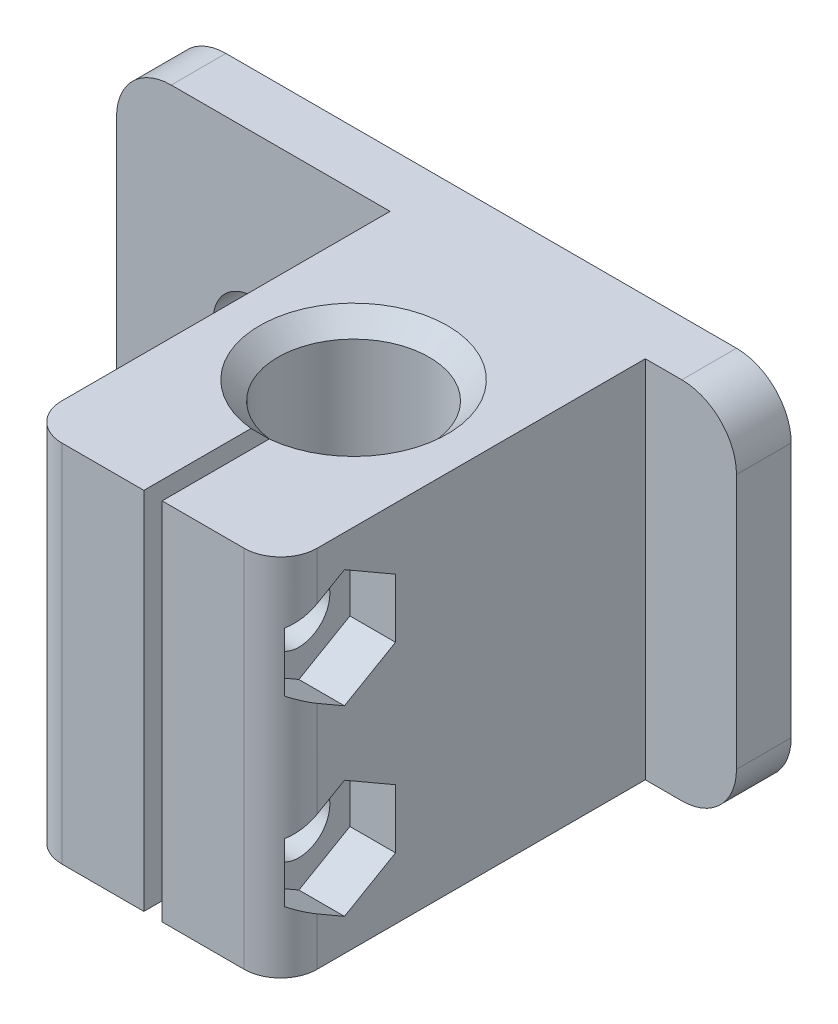
from build123d import *

# Parameters (mm, degrees)
SKETCH1_W           = 34
SKETCH1_H           = 20
BOSS_EXTRUDE1_DEPTH = 3
FILLET1_R           = 3
SKETCH2_W           = 14
SKETCH2_H           = 20
BOSS_EXTRUDE2_DEPTH = 20
CUT_EXTRUDE1_DEPTH  = 35.899856733
CHAMFER1_SIZE       = 1
SKETCH4_R           = 2.2
CUT_EXTRUDE2_DEPTH  = 29.08914381
SKETCH5_R           = 1.7
CUT_EXTRUDE3_DEPTH  = 39.340579025
FILLET2_R           = 2
CUT_EXTRUDE4_DEPTH  = 2.5
SKETCH7_R           = 2.75
CUT_EXTRUDE5_DEPTH  = 3


with BuildPart() as part:
    # Sketch1 → Boss-Extrude1 (new body)
    with BuildSketch(Plane.XY):
        Rectangle(SKETCH1_W, SKETCH1_H)
    extrude(amount=BOSS_EXTRUDE1_DEPTH)

    # Fillet1
    fillet1_edges = [part.edges().sort_by_distance(p)[0] for p in [
        (17, -10, 1.5),
        (-17, -10, 1.5),
        (-17, 10, 1.5),
        (17, 10, 1.5),
    ]]
    fillet(fillet1_edges, radius=FILLET1_R)

    # Sketch2 → Boss-Extrude2 (add)
    with BuildSketch(Plane.XY.offset(3)):
        with Locations((5, 0)):
            Rectangle(SKETCH2_W, SKETCH2_H)
    extrude(amount=BOSS_EXTRUDE2_DEPTH)

    # Sketch3 → Cut-Extrude1 (cut, through all)
    with BuildSketch(Plane(origin=(0, 10, 0), x_dir=(1, 0, 0), z_dir=(0, 1, 0))):
        with BuildLine():
            Line((4.5, -16.119769411), (4.5, -23))
            Line((4.5, -23), (5.5, -23))
            Line((5.5, -23), (5.5, -16.119769411))
            ThreePointArc((5.5, -16.119769411), (5, -7.85), (4.5, -16.119769411))
        make_face()
    extrude(amount=-CUT_EXTRUDE1_DEPTH, mode=Mode.SUBTRACT)

    # Chamfer1
    chamfer1_edges = [part.edges().sort_by_distance(p)[0] for p in [
        (5, -10, 7.85),
        (5, 10, 7.85),
    ]]
    chamfer(chamfer1_edges, length=CHAMFER1_SIZE)

    # Sketch4 → Cut-Extrude2 (cut, through all)
    with BuildSketch(Plane.XY.offset(3)):
        with Locations((-9.5, 0)):
            Circle(SKETCH4_R)
    extrude(amount=-CUT_EXTRUDE2_DEPTH, mode=Mode.SUBTRACT)

    # Sketch5 → Cut-Extrude3 (cut, through all)
    with BuildSketch(Plane(origin=(12, 0, 0), x_dir=(0, 0, -1), z_dir=(1, 0, 0))):
        with Locations(Location((-19.5, 5, 0), (0, 0, 90))):
            Circle(SKETCH5_R)
        with Locations(Location((-19.5, -5, 0), (0, 0, 90))):
            Circle(SKETCH5_R)
    extrude(amount=-CUT_EXTRUDE3_DEPTH, mode=Mode.SUBTRACT)

    # Fillet2
    # the kernel refuses this fillet: 2 mm, written as the material it takes off along each edge
    with BuildSketch(Plane(origin=(12, -15, 23), x_dir=(-1, 0, 0), z_dir=(0, 1, 0)), Plane(origin=(-2, 15, 23), x_dir=(1, 0, 0), z_dir=(0, -1, 0))) as fillet2_piece_1:
        with BuildLine():
            CenterArc((FILLET2_R, -FILLET2_R), FILLET2_R, 90, 90)
            Line((0, -FILLET2_R), (0, 0))
            Line((0, 0), (FILLET2_R, 0))
        make_face()
    extrude(amount=30, mode=Mode.SUBTRACT)

    # Sketch6 → Cut-Extrude4 (cut)
    with BuildSketch(Plane(origin=(12, 0, 0), x_dir=(0, 0, -1), z_dir=(1, 0, 0))):
        Polygon((-16.7, 3.383419246), (-16.7, 6.616580754), (-19.5, 8.233161507), (-22.3, 6.616580754), (-22.3, 3.383419246), (-19.5, 1.766838493), align=None)
        Polygon((-16.7, -3.383419246), (-19.5, -1.766838493), (-22.3, -3.383419246), (-22.3, -6.616580754), (-19.5, -8.233161507), (-16.7, -6.616580754), align=None)
    extrude(amount=-CUT_EXTRUDE4_DEPTH, mode=Mode.SUBTRACT)

    # Sketch7 → Cut-Extrude5 (cut)
    with BuildSketch(Plane.ZY.offset(2)):
        with Locations(Location((19.5, 5, 0), (0, 0, 270))):
            Circle(SKETCH7_R)
        with Locations(Location((19.5, -5, 0), (0, 0, 270))):
            Circle(SKETCH7_R)
    extrude(amount=-CUT_EXTRUDE5_DEPTH, mode=Mode.SUBTRACT)


solid = part.part
